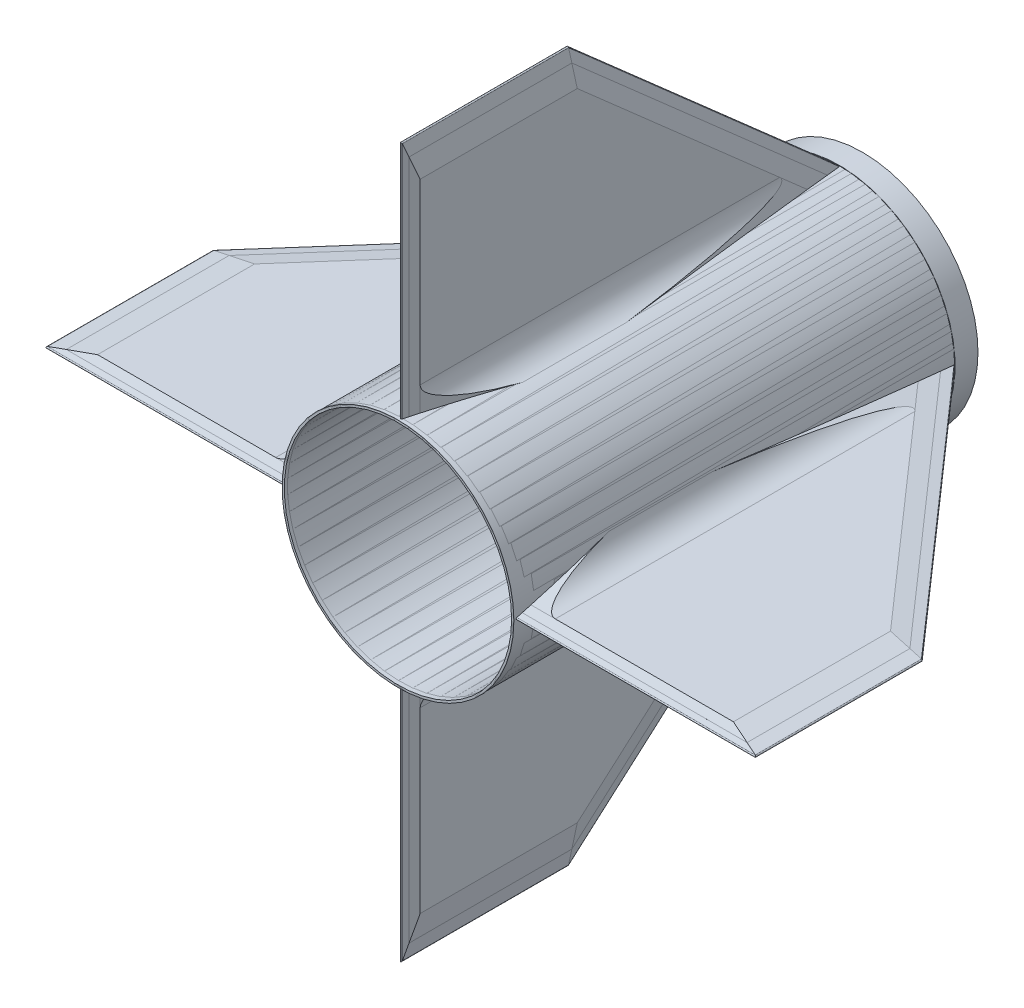
from build123d import *
from build123d.topology import SkipClean

# Parameters (mm, degrees)
FINBODY_DEPTH            = 3.175
CARBONFIBERX5_DEPTH      = 1.6002
CUT_EXTRUDE1_START       = 30.070082039
CUT_EXTRUDE1_OUTLINE_W   = 172
CUT_EXTRUDE1_OUTLINE_H   = 223
CUT_EXTRUDE1_DEPTH       = 3.929917961
CUT_EXTRUDE1_START_2     = 33.205646313
CUT_EXTRUDE1_2_OUTLINE_W = 172
CUT_EXTRUDE1_2_OUTLINE_H = 222
CUT_EXTRUDE1_2_DEPTH     = 3.794353687
CUT_EXTRUDE1_START_3     = -230
CUT_EXTRUDE1_3_DEPTH     = 340.7476603
CUT_EXTRUDE4_DEPTH       = 344.136185034
CUT_EXTRUDE4_DEPTH_BACK  = 344.136185034
CUT_EXTRUDE5_DEPTH       = 341.511591872
CUT_EXTRUDE5_DEPTH_BACK  = 341.511591872
SKETCH13_R               = 78.36
SKETCH13_R_2             = 77.09
BOSS_EXTRUDE1_DEPTH      = 914.4
BOSS_EXTRUDE2_REACH      = 934.109
BOSS_EXTRUDE3_START      = -56.951017769
BOSS_EXTRUDE3_DEPTH      = 70.189177625
BOSS_EXTRUDE3_START_2    = -274.544770627
BOSS_EXTRUDE3_2_DEPTH    = 262.648112268
BOSS_EXTRUDE3_START_3    = -88
BOSS_EXTRUDE3_3_DEPTH    = 101
CIRPATTERN1_COUNT        = 4
CIRPATTERN1_2_COUNT      = 4
CIRPATTERN1_3_COUNT      = 4
CIRPATTERN1_4_COUNT      = 4
CIRPATTERN1_5_COUNT      = 4
SKETCH18_W               = 519.548726742
SKETCH18_H               = 439.659397243
CUT_EXTRUDE6_DEPTH       = 615.0399
SKETCH17_R               = 78.614
SKETCH17_R_2             = 78.36
SKETCH17_R_3             = 77.09
BOSS_EXTRUDE4_DEPTH      = 0.1
SKETCH19_R               = 78.614
SKETCH19_R_2             = 77.09
BOSS_EXTRUDE5_DEPTH      = 0.1
SKETCH20_R               = 78.36
SKETCH20_R_2             = 77.09
BOSS_EXTRUDE6_DEPTH      = 914.4
SKETCH21_W               = 490.676006992
SKETCH21_H               = 455.150743556
CUT_EXTRUDE7_DEPTH       = 263.4
SKETCH22_R               = 78.36
SKETCH22_R_2             = 77.09
BOSS_EXTRUDE7_DEPTH      = 101.6
CUT_EXTRUDE8_START       = -752.6
SKETCH23_R               = 78.36
CUT_EXTRUDE8_DEPTH       = 752.6
BOSS_EXTRUDE8_DEPTH      = 289.69595
SKETCH25_R               = 78.359
SKETCH25_R_2             = 77.089
BOSS_EXTRUDE9_DEPTH      = 25.4


with BuildPart() as part:
    # Sketch1 → FinBody (new body)
    with BuildSketch(Plane(origin=(0, 0, 0), x_dir=(1, 0, 0), z_dir=(0, 1, 0))):
        Polygon((0, 0), (0, 304.8), (167.64, 114.3), (167.64, 0), align=None)
    extrude(amount=FINBODY_DEPTH)

    # Cut-Extrude1 3 outline → Cut-Extrude1 3 (cut)
    with BuildSketch(Plane(origin=(0, 0, 0), x_dir=(0.7507135169227551, 0, -0.660627894892025), z_dir=(0.660627894892025, 0, 0.7507135169227549)).offset(CUT_EXTRUDE1_START_3)):
        with BuildLine():
            Line((191.381223248, 3.175), (197.389983277, 2.219021404))
            add(Edge.make_bspline(
                [(197.389983277, 2.219021404), (197.765632434, 2.159256568), (197.765632434, 1.5875), (197.765632434, 1.015743432), (197.389983277, 0.955978596)],
                knots=[1.675516082, 1.675516082, 1.675516082, 3.141592654, 3.141592654, 4.607669225, 4.607669225, 4.607669225], degree=2, weights=[1, 0.743144825, 1, 0.743144825, 1]))
            Line((197.389983277, 0.955978596), (191.381223248, 0))
            Line((191.381223248, 0), (201.359382363, 0))
            Line((201.359382363, 0), (201.359382363, 3.175))
            Line((201.359382363, 3.175), (191.381223248, 3.175))
        make_face()
    extrude(amount=CUT_EXTRUDE1_3_DEPTH, mode=Mode.SUBTRACT)


with BuildPart() as body_2:
    # Sketch2 → CarbonFiberx5 (new body)
    with BuildSketch(Plane(origin=(0, 3.175, 0), x_dir=(1, 0, 0), z_dir=(0, 1, 0))):
        Polygon((0, 0), (167.64, 0), (167.64, 114.3), (0, 304.8), align=None)
    extrude(amount=CARBONFIBERX5_DEPTH)


with BuildPart() as body_3:
    # Mirror2: mirrored copy
    add(body_2.part.mirror(Plane.ZX.offset(1.5875)))

    # Cut-Extrude1: read off the stored shape, not the designer's step
    # Cut-Extrude1 outline → Cut-Extrude1 (cut)
    with BuildSketch(Plane(origin=(0, 0, 0), x_dir=(0.9930191618244789, 0.11730698463031215, 0.012329460910890686), z_dir=(0.11795314429640895, -0.9875792989546955, -0.10379876698083995)).offset(CUT_EXTRUDE1_START)):
        with Locations((81, -193.5)):
            Rectangle(CUT_EXTRUDE1_OUTLINE_W, CUT_EXTRUDE1_OUTLINE_H)
    extrude(amount=CUT_EXTRUDE1_DEPTH, mode=Mode.SUBTRACT)


with BuildPart() as body_2_1:
    add(body_2.part)

    # Cut-Extrude1 2 outline → Cut-Extrude1 2 (cut)
    with BuildSketch(Plane(origin=(0, 0, 0), x_dir=(0.9930191618244789, -0.11730698463031215, 0.012329460910890686), z_dir=(0.11795314429640895, 0.9875792989546955, -0.10379876698083995)).offset(CUT_EXTRUDE1_START_2)):
        with Locations((80, 193)):
            Rectangle(CUT_EXTRUDE1_2_OUTLINE_W, CUT_EXTRUDE1_2_OUTLINE_H)
    extrude(amount=CUT_EXTRUDE1_2_DEPTH, mode=Mode.SUBTRACT)


with BuildPart() as cut_extrude4_tool:
    # Sketch11 → Cut-Extrude4 (new, two sides: drawn at the far end of the back side and taken through both)
    with BuildSketch(Plane.XY.offset(-CUT_EXTRUDE4_DEPTH_BACK)):
        with BuildLine():
            Line((152.535946429, 3.175), (161.631475206, 2.219021404))
            ThreePointArc((161.631475206, 2.219021404), (162.200099632, 1.5875), (161.631475206, 0.955978596))
            Line((161.631475206, 0.955978596), (152.535946429, 0))
            Line((152.535946429, 0), (167.64, 0))
            Line((167.64, 0), (167.64, 3.175))
            Line((167.64, 3.175), (152.535946429, 3.175))
        make_face()
        Polygon((137.311060429, 4.7752), (152.535946429, 3.175), (167.64, 3.175), (167.64, 4.7752), align=None)
        Polygon((167.64, 0), (152.535946429, 0), (137.311060429, -1.6002), (167.64, -1.6002), align=None)
    extrude(amount=CUT_EXTRUDE4_DEPTH + CUT_EXTRUDE4_DEPTH_BACK)


with BuildPart() as part_1:
    add(part.part)

    # Cut-Extrude4: cut by cut_extrude4_tool
    add(cut_extrude4_tool.part, mode=Mode.SUBTRACT)


with BuildPart() as body_2_2:
    add(body_2_1.part)

    # Cut-Extrude4: cut by cut_extrude4_tool
    add(cut_extrude4_tool.part, mode=Mode.SUBTRACT)


with BuildPart() as body_3_1:
    add(body_3.part)

    # Cut-Extrude4: cut by cut_extrude4_tool
    add(cut_extrude4_tool.part, mode=Mode.SUBTRACT)


with BuildPart() as cut_extrude5_tool:
    # Sketch12 → Cut-Extrude5 (new, two sides: drawn at the far end of the back side and taken through both)
    with BuildSketch(Plane.ZY.offset(-CUT_EXTRUDE5_DEPTH_BACK)):
        with BuildLine():
            Line((-5.924630657, 3.175), (-2.289101505, 2.2008629))
            ThreePointArc((-2.289101505, 2.2008629), (-1.818451599, 1.5875), (-2.289101505, 0.9741371))
            Line((-2.289101505, 0.9741371), (-5.924630657, 0))
            Line((-5.924630657, 0), (0, 0))
            Line((0, 0), (0, 3.175))
            Line((0, 3.175), (-5.924630657, 3.175))
        make_face()
        Polygon((-11.896658359, 4.7752), (-5.924630657, 3.175), (0, 3.175), (0, 4.7752), align=None)
        Polygon((0, 0), (-5.924630657, 0), (-11.896658359, -1.6002), (0, -1.6002), align=None)
    extrude(amount=CUT_EXTRUDE5_DEPTH + CUT_EXTRUDE5_DEPTH_BACK)


with BuildPart() as part_2:
    add(part_1.part)

    # Cut-Extrude5: cut by cut_extrude5_tool
    add(cut_extrude5_tool.part, mode=Mode.SUBTRACT)



with BuildPart() as body_2_3:
    add(body_2_2.part)

    # Cut-Extrude5: cut by cut_extrude5_tool
    add(cut_extrude5_tool.part, mode=Mode.SUBTRACT)

    # CirPattern1 4: body 2 ×4 about axis
    cirpattern1_4_axis = Axis((-78.36, 1.5875, 0), (0, 0, 1))


with BuildPart() as body_3_2:
    add(body_3_1.part)

    # Cut-Extrude5: cut by cut_extrude5_tool
    add(cut_extrude5_tool.part, mode=Mode.SUBTRACT)

    # CirPattern1 2: body 3 ×4 about axis
    cirpattern1_2_axis = Axis((-78.36, 1.5875, 0), (0, 0, 1))


with BuildPart() as body_4:
    # Sketch13 → Boss-Extrude1 (new body)
    with BuildSketch(Plane.XY):
        with Locations((-78.36, 1.5875)):
            Circle(SKETCH13_R)
        with Locations((-78.36, 1.5875)):
            Circle(SKETCH13_R_2, mode=Mode.SUBTRACT)
    extrude(amount=-BOSS_EXTRUDE1_DEPTH)


with BuildPart() as part_3:
    add(part_2.part)

    # Boss-Extrude2: up to this face of the body
    boss_extrude2_end = body_4.part.faces().sort_by_distance((-156.72, 1.5875, -457.2))[0]
    # Sketch14 → Boss-Extrude2 (add, up to the picked face)
    with BuildSketch(Plane.ZY, mode=Mode.PRIVATE) as boss_extrude2_sk1:
        with BuildLine():
            ThreePointArc((-2.289101505, 0.9741371), (-1.818451599, 1.5875), (-2.289101505, 2.2008629))
            Line((-2.289101505, 2.2008629), (-5.924630657, 3.175))
            Line((-5.924630657, 3.175), (-289.695946429, 3.175))
            Line((-289.695946429, 3.175), (-298.791475206, 2.219021404))
            ThreePointArc((-298.791475206, 2.219021404), (-299.360099632, 1.5875), (-298.791475206, 0.955978596))
            Line((-298.791475206, 0.955978596), (-289.695946429, 0))
            Line((-289.695946429, 0), (-5.924630657, 0))
            Line((-5.924630657, 0), (-2.289101505, 0.9741371))
        make_face()
    boss_extrude2_tool1 = split(extrude(boss_extrude2_sk1.sketch, amount=BOSS_EXTRUDE2_REACH, mode=Mode.PRIVATE), bisect_by=boss_extrude2_end, keep=Keep.BOTH, mode=Mode.PRIVATE)
    # Sketch14 → Boss-Extrude2 (add, up to the picked face)
    with BuildSketch(Plane.ZY, mode=Mode.PRIVATE) as boss_extrude2_sk2:
        Polygon((-289.695946429, 3.175), (-5.924630657, 3.175), (-11.896658359, 4.7752), (-274.471060429, 4.7752), align=None)
    boss_extrude2_tool2 = split(extrude(boss_extrude2_sk2.sketch, amount=BOSS_EXTRUDE2_REACH, mode=Mode.PRIVATE), bisect_by=boss_extrude2_end, keep=Keep.BOTH, mode=Mode.PRIVATE)
    # Sketch14 → Boss-Extrude2 (add, up to the picked face)
    with BuildSketch(Plane.ZY, mode=Mode.PRIVATE) as boss_extrude2_sk3:
        Polygon((-11.896658359, -1.6002), (-5.924630657, 0), (-289.695946429, 0), (-274.471060429, -1.6002), align=None)
    boss_extrude2_tool3 = split(extrude(boss_extrude2_sk3.sketch, amount=BOSS_EXTRUDE2_REACH, mode=Mode.PRIVATE), bisect_by=boss_extrude2_end, keep=Keep.BOTH, mode=Mode.PRIVATE)
    add(boss_extrude2_tool1.solids().sort_by(Axis((0, 1.5875, -149.762129), (-1, 0, 0)))[0])
    add(boss_extrude2_tool1.solids().sort_by(Axis((0, 1.5875, -149.762129), (-1, 0, 0)))[1])
    add(boss_extrude2_tool2.solids().sort_by(Axis((0, 3.964753, -145.52699), (-1, 0, 0)))[0])
    add(boss_extrude2_tool3.solids().sort_by(Axis((0, -0.789753, -145.52699), (-1, 0, 0)))[0])

    # CirPattern1 3: part ×4 about axis
    cirpattern1_3_axis = Axis((-78.36, 1.5875, 0), (0, 0, 1))


with BuildPart() as body_5:
    # Boss-Extrude3: read off the stored shape, not the designer's step
    # Boss-Extrude3 outline → Boss-Extrude3 (new body)
    with BuildSketch(Plane.XY.offset(-80).offset(BOSS_EXTRUDE3_START)):
        with BuildLine():
            Line((-0.064864974, 4.7752), (16.477718228, 4.7752))
            ThreePointArc((16.477718228, 4.7752), (4.644384042, 8.896211353), (-2.069233135, 19.476281152))
            ThreePointArc((-2.069233135, 19.476281152), (-0.718318458, 12.173287045), (-0.064864974, 4.7752))
        make_face()
    extrude(amount=BOSS_EXTRUDE3_DEPTH)

    # Boss-Extrude3 2 outline → Boss-Extrude3 2 (add)
    with BuildSketch(Plane.XY.offset(BOSS_EXTRUDE3_START_2)):
        with BuildLine():
            Line((-0.064864974, 4.7752), (16.477718228, 4.7752))
            ThreePointArc((16.477718228, 4.7752), (4.644384042, 8.896211353), (-2.069233135, 19.476281152))
            ThreePointArc((-2.069233135, 19.476281152), (-0.718318458, 12.173287045), (-0.064864974, 4.7752))
        make_face()
    extrude(amount=BOSS_EXTRUDE3_2_DEPTH)

    # Boss-Extrude3 3 outline → Boss-Extrude3 3 (cut)
    with BuildSketch(Plane(origin=(0, 0, 0), x_dir=(0.07755232947375353, 0.9966790611369077, 0.024829121701067894), z_dir=(0.9492172233880417, -0.08143002573530268, 0.30390099330578807)).offset(BOSS_EXTRUDE3_START_3)):
        Polygon((4.458927845, -11.310361504), (17.593489909, -62.951705289), (20, -72.413415114), (20, -9), (3.871305906, -9), align=None)
        Polygon((20, -268), (20, -99.303590445), (-2.062394099, -261.451175711), (-2.953451108, -268), align=None)
    extrude(amount=BOSS_EXTRUDE3_3_DEPTH, mode=Mode.SUBTRACT)


with BuildPart() as body_6:
    # Mirror3: mirrored copy
    add(body_5.part.mirror(Plane.ZX.offset(1.5875)))

    # CirPattern1: body 6 ×4 about axis
    cirpattern1_axis = Axis((-78.36, 1.5875, 0), (0, 0, 1))


with BuildPart() as body_6_1:
    add(body_6.part)
    for i in range(1, CIRPATTERN1_COUNT):
        add(body_6.part.rotate(cirpattern1_axis, i * 360 / CIRPATTERN1_COUNT))


with BuildPart() as body_3_3:
    add(body_3_2.part)
    for i in range(1, CIRPATTERN1_2_COUNT):
        add(body_3_2.part.rotate(cirpattern1_2_axis, i * 360 / CIRPATTERN1_2_COUNT))


with BuildPart() as part_4:
    add(part_3.part)
    for i in range(1, CIRPATTERN1_3_COUNT):
        add(part_3.part.rotate(cirpattern1_3_axis, i * 360 / CIRPATTERN1_3_COUNT))


with BuildPart() as body_2_4:
    add(body_2_3.part)
    for i in range(1, CIRPATTERN1_4_COUNT):
        add(body_2_3.part.rotate(cirpattern1_4_axis, i * 360 / CIRPATTERN1_4_COUNT))


with BuildPart() as body_5_1:
    add(body_5.part)

    # CirPattern1 5: body 5 ×4 about axis
    cirpattern1_5_axis = Axis((-78.36, 1.5875, 0), (0, 0, 1))


with BuildPart() as body_5_2:
    add(body_5_1.part)
    for i in range(1, CIRPATTERN1_5_COUNT):
        add(body_5_1.part.rotate(cirpattern1_5_axis, i * 360 / CIRPATTERN1_5_COUNT))


with BuildPart() as body_4_1:
    add(body_4.part)

    # Sketch18 → Cut-Extrude6 (cut)
    with BuildSketch(Plane(origin=(0, 0, -914.4), x_dir=(-1, 0, 0), z_dir=(0, 0, -1))):
        with Locations((83.18552997, 2.793882493)):
            Rectangle(SKETCH18_W, SKETCH18_H)
    extrude(amount=-CUT_EXTRUDE6_DEPTH, mode=Mode.SUBTRACT)

    # Sketch17 → Boss-Extrude4 (add)
    # profile 1 of 2: a face of its own
    with BuildSketch(Plane.XY):
        with Locations((-78.36, 1.5875)):
            Circle(SKETCH17_R)
        with Locations((-78.36, 1.5875)):
            Circle(SKETCH17_R_2, mode=Mode.SUBTRACT)
    # profile 2 of 2: a face of its own
    with BuildSketch(Plane.XY):
        with Locations((-78.36, 1.5875)):
            Circle(SKETCH17_R_2)
        with Locations((-78.36, 1.5875)):
            Circle(SKETCH17_R_3, mode=Mode.SUBTRACT)
    extrude(amount=-BOSS_EXTRUDE4_DEPTH)

    # Sketch19 → Boss-Extrude5 (add)
    with BuildSketch(Plane(origin=(0, 0, -299.360099632), x_dir=(-1, 0, 0), z_dir=(0, 0, -1))):
        with Locations(Location((78.36, 1.5875, 0), (0, 0, 180))):
            Circle(SKETCH19_R)
        with Locations(Location((78.36, 1.5875, 0), (0, 0, 180))):
            Circle(SKETCH19_R_2, mode=Mode.SUBTRACT)
    extrude(amount=-BOSS_EXTRUDE5_DEPTH)

    # Sketch20 → Boss-Extrude6 (add)
    with BuildSketch(Plane(origin=(0, 0, -299.360099632), x_dir=(-1, 0, 0), z_dir=(0, 0, -1))):
        with Locations(Location((78.36, 1.5875, 0), (0, 0, 180))):
            Circle(SKETCH20_R)
        with Locations(Location((78.36, 1.5875, 0), (0, 0, 180))):
            Circle(SKETCH20_R_2, mode=Mode.SUBTRACT)
    extrude(amount=BOSS_EXTRUDE6_DEPTH)

    # Sketch21 → Cut-Extrude7 (cut)
    with BuildSketch(Plane(origin=(0, 0, -1213.760099632), x_dir=(-1, 0, 0), z_dir=(0, 0, -1))):
        with Locations((78.493553622, -8.429021645)):
            Rectangle(SKETCH21_W, SKETCH21_H)
    extrude(amount=-CUT_EXTRUDE7_DEPTH, mode=Mode.SUBTRACT)

    # Sketch22 → Boss-Extrude7 (add)
    with BuildSketch(Plane(origin=(0, 0, -950.360099632), x_dir=(-1, 0, 0), z_dir=(0, 0, -1))):
        with Locations(Location((78.36, 1.5875, 0), (0, 0, 180))):
            Circle(SKETCH22_R)
        with Locations(Location((78.36, 1.5875, 0), (0, 0, 180))):
            Circle(SKETCH22_R_2, mode=Mode.SUBTRACT)
    extrude(amount=BOSS_EXTRUDE7_DEPTH)

    # Sketch23 → Cut-Extrude8 (cut)
    with BuildSketch(Plane(origin=(0, 0, -1051.960099632), x_dir=(-1, 0, 0), z_dir=(0, 0, -1)).offset(CUT_EXTRUDE8_START)):
        with Locations(Location((78.36, 1.5875, 0), (0, 0, 180))):
            Circle(SKETCH23_R)
    extrude(amount=CUT_EXTRUDE8_DEPTH, mode=Mode.SUBTRACT)


with BuildPart() as body_7:
    # Sketch24 → Boss-Extrude8 (new body)
    with BuildSketch(Plane.XY):
        with BuildLine():
            ThreePointArc((-0.001, 1.5875), (-24.089577634, 58.110540764), (-81.545025249, 79.881743053))
            Line((-81.545025249, 79.881743053), (-81.493404094, 78.612792598))
            ThreePointArc((-81.493404094, 78.612792598), (-24.969163086, 57.1944461), (-1.271, 1.5875))
            ThreePointArc((-1.271, 1.5875), (-1.286928496, 0.020474167), (-1.334707402, -1.545904094))
            Line((-1.334707402, -1.545904094), (-0.065756947, -1.597525249))
            ThreePointArc((-0.065756947, -1.597525249), (-0.01719091, -0.005341745), (-0.001, 1.5875))
        make_face()
        with BuildLine():
            Line((-81.493404094, 78.612792598), (-81.545025249, 79.881743053))
            ThreePointArc((-81.545025249, 79.881743053), (-133.768180267, 56.995680267), (-156.654243053, 4.772525249))
            Line((-156.654243053, 4.772525249), (-155.385292598, 4.720904094))
            ThreePointArc((-155.385292598, 4.720904094), (-132.870154655, 56.097654655), (-81.493404094, 78.612792598))
        make_face()
        with BuildLine():
            Line((-155.385292598, 4.720904094), (-156.654243053, 4.772525249))
            ThreePointArc((-156.654243053, 4.772525249), (-133.768180267, -53.820680267), (-75.174974751, -76.706743053))
            Line((-75.174974751, -76.706743053), (-75.226595906, -75.437792598))
            ThreePointArc((-75.226595906, -75.437792598), (-132.870154655, -52.922654655), (-155.385292598, 4.720904094))
        make_face()
        with BuildLine():
            ThreePointArc((-75.174974751, -76.706743053), (-22.951819733, -53.820680267), (-0.065756947, -1.597525249))
            Line((-0.065756947, -1.597525249), (-1.334707402, -1.545904094))
            ThreePointArc((-1.334707402, -1.545904094), (-23.849845345, -52.922654655), (-75.226595906, -75.437792598))
            Line((-75.226595906, -75.437792598), (-75.174974751, -76.706743053))
        make_face()
    extrude(amount=-BOSS_EXTRUDE8_DEPTH)

    # Sketch25 → Boss-Extrude9 (add)
    with SkipClean():  # the faces are left unmerged after this step: merging them gives an invalid solid
        with BuildSketch(Plane(origin=(0, 0, -289.695946429), x_dir=(-1, 0, 0), z_dir=(0, 0, -1))):
            with Locations(Location((78.36, 1.5875, 0), (0, 0, 180))):
                Circle(SKETCH25_R)
            with Locations(Location((78.36, 1.5875, 0), (0, 0, 180))):
                Circle(SKETCH25_R_2, mode=Mode.SUBTRACT)
        extrude(amount=BOSS_EXTRUDE9_DEPTH)


solid = Compound([body_6_1.part, body_3_3.part, part_4.part, body_2_4.part, body_5_2.part, body_4_1.part, body_7.part])
